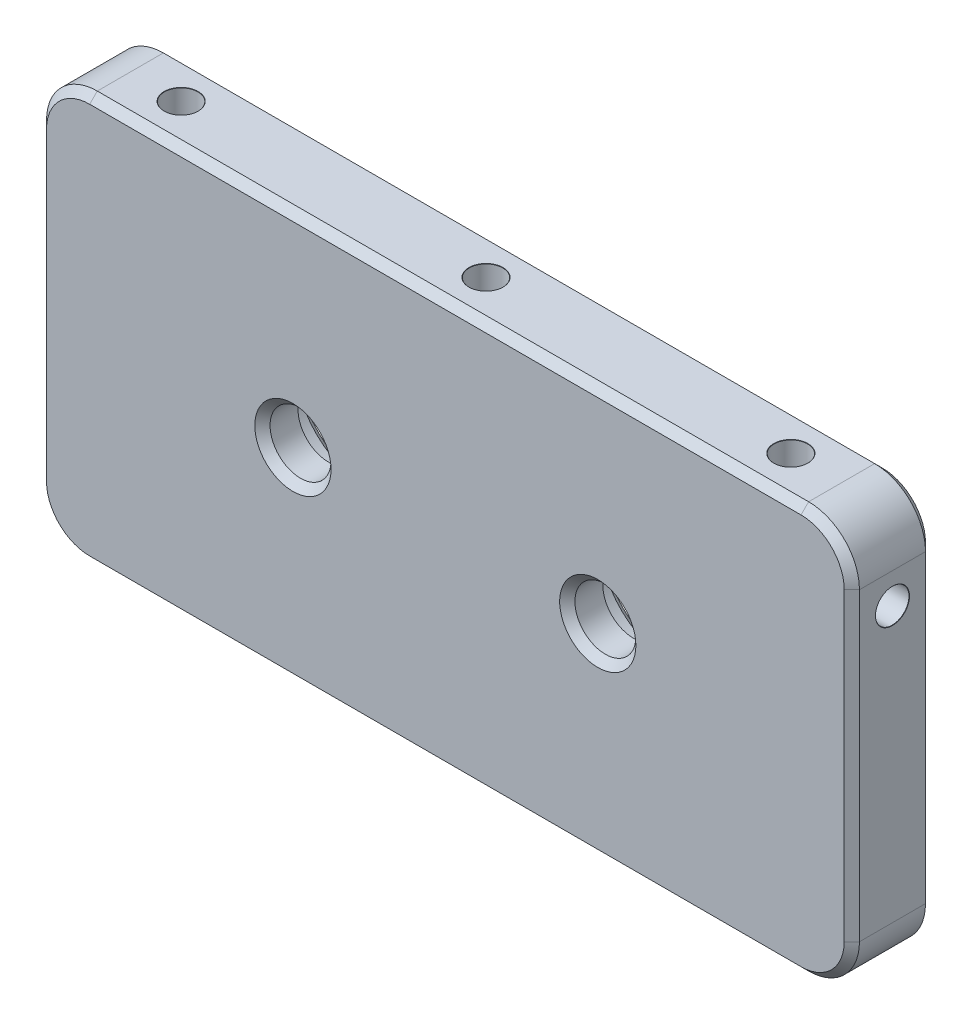
from build123d import *

# Parameters (mm, degrees)
SKETCH1_W                             = 80
SKETCH1_H                             = 40
SKETCH1_R                             = 7
SKETCH1_R_2                           = 3
BOSS_EXTRUDE1_DEPTH                   = 8
CUT_EXTRUDE1_OUTLINE_R                = 7
CUT_EXTRUDE1_OUTLINE_R_2              = 3
CUT_EXTRUDE1_DEPTH                    = 4.5
FILLET1_R                             = 5
TAP_DRILL_FOR_M4X0_7_TAP1_D           = 3.3
TAP_DRILL_FOR_M4X0_7_TAP1_DEPTH       = 12
TAP_DRILL_FOR_M4X0_7_TAP1_CSINK_D     = 3.35
TAP_DRILL_FOR_M4X0_7_TAP1_CSINK_ANGLE = 90
TAP_DRILL_FOR_M4X0_7_TAP1_TIP         = 0.991420021
TAP_DRILL_FOR_M4X0_7_TAP2_D           = 3.3
TAP_DRILL_FOR_M4X0_7_TAP2_DEPTH       = 12
TAP_DRILL_FOR_M4X0_7_TAP2_CSINK_D     = 3.35
TAP_DRILL_FOR_M4X0_7_TAP2_CSINK_ANGLE = 90
TAP_DRILL_FOR_M4X0_7_TAP2_TIP         = 0.991420021
TAP_DRILL_FOR_M4X0_7_TAP3_D           = 3.3
TAP_DRILL_FOR_M4X0_7_TAP3_DEPTH       = 12
TAP_DRILL_FOR_M4X0_7_TAP3_CSINK_D     = 3.35
TAP_DRILL_FOR_M4X0_7_TAP3_CSINK_ANGLE = 90
TAP_DRILL_FOR_M4X0_7_TAP3_TIP         = 0.991420021
CHAMFER1_SIZE                         = 0.75


# Read off the part's stored shape, not the designer's step: Cut-Extrude1
with BuildPart() as part:
    # Sketch1 → Boss-Extrude1 (new body)
    # profile 1 of 3: a face of its own
    with BuildSketch(Plane.XY):
        Rectangle(SKETCH1_W, SKETCH1_H)
        with Locations((15, 0)):
            Circle(SKETCH1_R, mode=Mode.SUBTRACT)
        with Locations((-15, 0)):
            Circle(SKETCH1_R, mode=Mode.SUBTRACT)
    # profile 2 of 3: a face of its own
    with BuildSketch(Plane.XY):
        with Locations((-15, 0)):
            Circle(SKETCH1_R)
        with Locations((-15, 0)):
            Circle(SKETCH1_R_2, mode=Mode.SUBTRACT)
    # profile 3 of 3: a face of its own
    with BuildSketch(Plane.XY):
        with Locations((15, 0)):
            Circle(SKETCH1_R)
        with Locations((15, 0)):
            Circle(SKETCH1_R_2, mode=Mode.SUBTRACT)
    extrude(amount=BOSS_EXTRUDE1_DEPTH)

    # Cut-Extrude1 outline → Cut-Extrude1 (cut)
    # profile 1 of 2: a face of its own
    with BuildSketch(Plane.XY):
        with Locations((-15, 0)):
            Circle(CUT_EXTRUDE1_OUTLINE_R)
        with Locations((-15, 0)):
            Circle(CUT_EXTRUDE1_OUTLINE_R_2, mode=Mode.SUBTRACT)
    # profile 2 of 2: a face of its own
    with BuildSketch(Plane.XY):
        with Locations((15, 0)):
            Circle(CUT_EXTRUDE1_OUTLINE_R)
        with Locations((15, 0)):
            Circle(CUT_EXTRUDE1_OUTLINE_R_2, mode=Mode.SUBTRACT)
    extrude(amount=CUT_EXTRUDE1_DEPTH, mode=Mode.SUBTRACT)

    # Fillet1
    fillet1_edges = [part.edges().sort_by_distance(p)[0] for p in [
        (40, -20, 4),
        (-40, -20, 4),
        (-40, 20, 4),
        (40, 20, 4),
    ]]
    fillet(fillet1_edges, radius=FILLET1_R)

    # Tap Drill for M4x0.7 Tap1
    with Locations(Plane(origin=(0, 20, 0), x_dir=(1, 0, 0), z_dir=(0, 1, 0))):
        with Locations((30, -4), (0, -4), (-30, -4)):
            CounterSinkHole(TAP_DRILL_FOR_M4X0_7_TAP1_D / 2, TAP_DRILL_FOR_M4X0_7_TAP1_CSINK_D / 2, depth=TAP_DRILL_FOR_M4X0_7_TAP1_DEPTH, counter_sink_angle=TAP_DRILL_FOR_M4X0_7_TAP1_CSINK_ANGLE)
            with Locations((0, 0, -(TAP_DRILL_FOR_M4X0_7_TAP1_DEPTH + TAP_DRILL_FOR_M4X0_7_TAP1_TIP / 2))):  # 118° drill point
                Cone(0, TAP_DRILL_FOR_M4X0_7_TAP1_D / 2, TAP_DRILL_FOR_M4X0_7_TAP1_TIP, mode=Mode.SUBTRACT)

    # Tap Drill for M4x0.7 Tap2
    with Locations(Plane(origin=(40, 0, 0), x_dir=(0, 0, -1), z_dir=(1, 0, 0))):
        with Locations((-4, 12)):
            CounterSinkHole(TAP_DRILL_FOR_M4X0_7_TAP2_D / 2, TAP_DRILL_FOR_M4X0_7_TAP2_CSINK_D / 2, depth=TAP_DRILL_FOR_M4X0_7_TAP2_DEPTH, counter_sink_angle=TAP_DRILL_FOR_M4X0_7_TAP2_CSINK_ANGLE)
            with Locations((0, 0, -(TAP_DRILL_FOR_M4X0_7_TAP2_DEPTH + TAP_DRILL_FOR_M4X0_7_TAP2_TIP / 2))):  # 118° drill point
                Cone(0, TAP_DRILL_FOR_M4X0_7_TAP2_D / 2, TAP_DRILL_FOR_M4X0_7_TAP2_TIP, mode=Mode.SUBTRACT)

    # Tap Drill for M4x0.7 Tap3
    with Locations(Plane.ZY.offset(40)):
        with Locations((4, 12)):
            CounterSinkHole(TAP_DRILL_FOR_M4X0_7_TAP3_D / 2, TAP_DRILL_FOR_M4X0_7_TAP3_CSINK_D / 2, depth=TAP_DRILL_FOR_M4X0_7_TAP3_DEPTH, counter_sink_angle=TAP_DRILL_FOR_M4X0_7_TAP3_CSINK_ANGLE)
            with Locations((0, 0, -(TAP_DRILL_FOR_M4X0_7_TAP3_DEPTH + TAP_DRILL_FOR_M4X0_7_TAP3_TIP / 2))):  # 118° drill point
                Cone(0, TAP_DRILL_FOR_M4X0_7_TAP3_D / 2, TAP_DRILL_FOR_M4X0_7_TAP3_TIP, mode=Mode.SUBTRACT)

    # Chamfer1
    chamfer1_edges = [part.edges().sort_by_distance(p)[0] for p in [
        (8, 0, 0),
        (-18, 0, 8),
        (-22, 0, 0),
        (12, 0, 8),
        (40, 0, 0),
        (40, 0, 8),
        (0, -20, 0),
        (-40, 0, 0),
        (0, 20, 0),
        (38.535533906, 18.535533906, 0),
        (-38.535533906, 18.535533906, 0),
        (-38.535533906, -18.535533906, 0),
        (38.535533906, -18.535533906, 0),
        (0, -20, 8),
        (0, 20, 8),
        (-40, 0, 8),
        (38.535533906, 18.535533906, 8),
        (-38.535533906, 18.535533906, 8),
        (-38.535533906, -18.535533906, 8),
        (38.535533906, -18.535533906, 8),
    ]]
    chamfer(chamfer1_edges, length=CHAMFER1_SIZE)


solid = part.part
